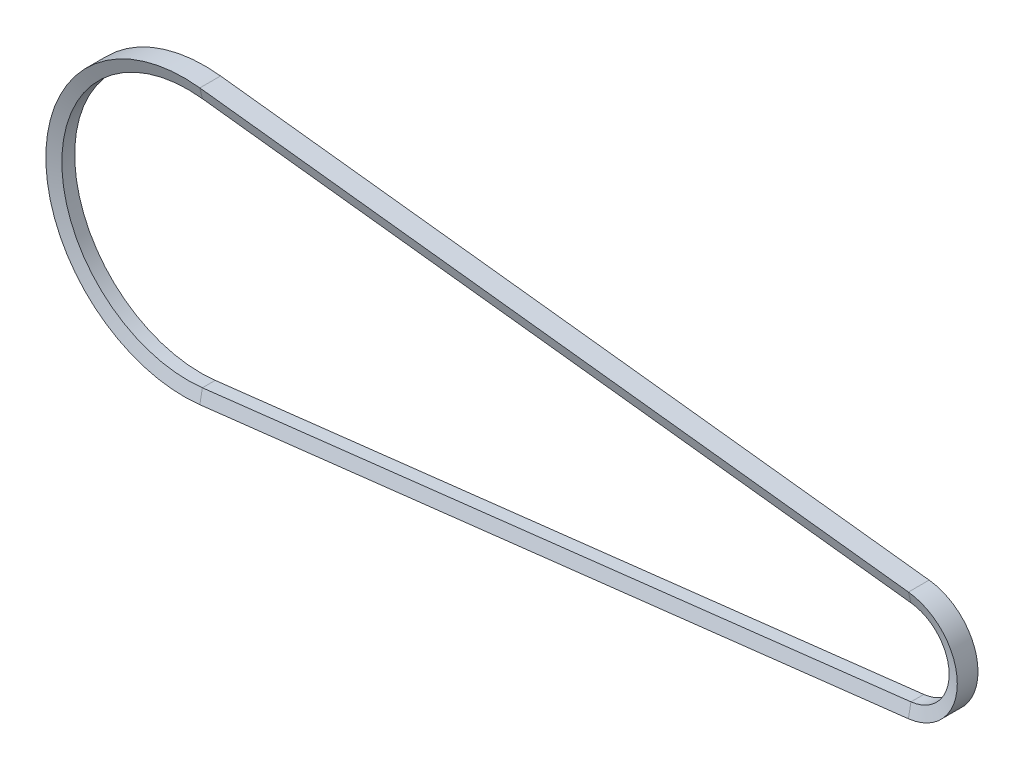
from build123d import *


with BuildPart() as part:
    # Sweep1: sweep along a path in Sketch1
    with BuildLine(Plane.XY) as sweep1_path:
        Line((7.326923077, 63.075876516), (333.130769231, 25.230350606))
        ThreePointArc((333.130769231, 25.230350606), (355.6, 0), (333.130769231, -25.230350606))
        Line((333.130769231, -25.230350606), (7.326923077, -63.075876516))
        ThreePointArc((7.326923077, -63.075876516), (-63.5, 0), (7.326923077, 63.075876516))
    # Sketch2 → Sweep1 (sweep)
    with BuildSketch(Plane(origin=(0, 0, 0), x_dir=(0, 0, -1), z_dir=(1, 0, 0))):
        Polygon((-4.7625, 63.5), (4.7625, 63.5), (2.957164938, 57.94375), (-2.957164938, 57.94375), align=None)
    sweep(path=sweep1_path.line)


solid = part.part
